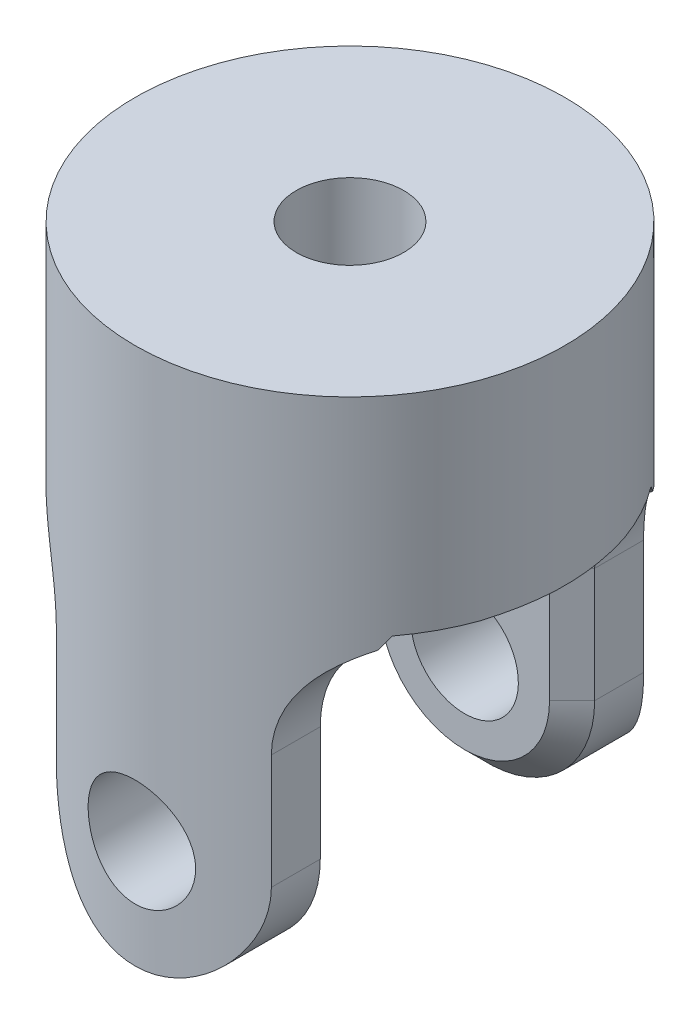
from build123d import *

# Parameters (mm, degrees)
SKETCH1_R               = 19.05
BASE_EXTRUDE_DEPTH      = 47.625
CUT_EXTRUDE1_DEPTH      = 55.716959208
CUT_EXTRUDE1_DEPTH_BACK = 55.716959208
CUT_EXTRUDE5_DEPTH      = 55.716959365
CUT_EXTRUDE5_DEPTH_BACK = 55.716959365
CUT_EXTRUDE6_DEPTH      = 55.716959365
CUT_EXTRUDE6_DEPTH_BACK = 55.716959365
SKETCH11_R              = 4.7625
SKETCH12_R              = 4.7625
CUT_EXTRUDE7_DEPTH      = 55.716959365
CHAMFER1_SIZE           = 2


with BuildPart() as part:
    # Sketch1 → Base-Extrude (new body)
    with BuildSketch(Plane(origin=(0, 0, 0), x_dir=(-1, 0, 0), z_dir=(0, 1, 0))):
        with Locations(Location((0, 0, 0), (0, 0, 90))):
            Circle(SKETCH1_R)
    extrude(amount=BASE_EXTRUDE_DEPTH)

    # Sketch2 → Cut-Extrude1 (cut, two sides: drawn at the far end of the back side and taken through both)
    with BuildSketch(Plane.XY.offset(-CUT_EXTRUDE1_DEPTH_BACK)):
        with BuildLine():
            Line((-19.05, -131.979516723), (-19.05, 0))
            Line((-19.05, 0), (-19.05, 29.21))
            ThreePointArc((-19.05, 29.21), (-12.314807909, 26.420192091), (-9.525, 19.685))
            Line((-9.525, 19.685), (-9.525, 9.525))
            ThreePointArc((-9.525, 9.525), (0, 0), (9.525, 9.525))
            Line((9.525, 9.525), (9.525, 19.685))
            ThreePointArc((9.525, 19.685), (12.314807909, 26.420192091), (19.05, 29.21))
            Line((19.05, 29.21), (19.05, 0))
            Line((19.05, 0), (19.05, -131.979516723))
            Line((19.05, -131.979516723), (19.05, -395.938550169))
            Line((19.05, -395.938550169), (-19.05, -395.938550169))
            Line((-19.05, -395.938550169), (-19.05, -131.979516723))
        make_face()
    extrude(amount=CUT_EXTRUDE1_DEPTH + CUT_EXTRUDE1_DEPTH_BACK, mode=Mode.SUBTRACT)

    # Sketch8 → Cut-Extrude5 (cut, two sides: drawn at the far end of the back side and taken through both)
    with BuildSketch(Plane(origin=(0, 0, 0), x_dir=(0, 0, -1), z_dir=(1, 0, 0)).offset(-CUT_EXTRUDE5_DEPTH_BACK)):
        Polygon((-10.16, -121.738350451), (-10.16, 0), (-10.16, 29.145238826), (10.16, 29.145238826), (10.16, 0), (10.16, -121.738350451), (10.16, -365.215051352), (-10.16, -365.215051352), align=None)
    extrude(amount=CUT_EXTRUDE5_DEPTH + CUT_EXTRUDE5_DEPTH_BACK, mode=Mode.SUBTRACT)

    # Sketch11 → Cut-Extrude6 (cut, two sides: drawn at the far end of the back side and taken through both)
    with BuildSketch(Plane.XY.offset(-CUT_EXTRUDE6_DEPTH_BACK)):
        with Locations(Location((0, 9.525, 0), (0, 0, 90))):
            Circle(SKETCH11_R)
    extrude(amount=CUT_EXTRUDE6_DEPTH + CUT_EXTRUDE6_DEPTH_BACK, mode=Mode.SUBTRACT)

    # Sketch12 → Cut-Extrude7 (cut, through all)
    with BuildSketch(Plane(origin=(0, 47.625, 0), x_dir=(-1, 0, 0), z_dir=(0, 1, 0))):
        with Locations(Location((0, 0, 0), (0, 0, 90))):
            Circle(SKETCH12_R)
    extrude(amount=-CUT_EXTRUDE7_DEPTH, mode=Mode.SUBTRACT)

    # Chamfer1
    # the kernel refuses this chamfer: 2 mm, written as the material it takes off along each edge
    with BuildSketch(Plane(origin=(19.05, 19.685, 10.16), x_dir=(-1, 0, 0), z_dir=(0, -1, 0))) as chamfer1_piece_1_section:
        Polygon((9.525, -CHAMFER1_SIZE), (9.525 + CHAMFER1_SIZE, 0), (9.525, 0), align=None)
    chamfer1_piece_1 = revolve(axis=Axis((19.05, 19.685, 10.16), (0, 0, -1)), revolution_arc=102.996714199, mode=Mode.PRIVATE)
    chamfer1_piece_1 = split(chamfer1_piece_1, bisect_by=Plane(origin=(11.833499509, 29.145238826, 10.8595535), z_dir=(0, -1, 0)), keep=Keep.TOP, mode=Mode.PRIVATE)
    add(chamfer1_piece_1, mode=Mode.SUBTRACT)
    with BuildSketch(Plane(origin=(9.525, 9.525, 10.16), x_dir=(0.027495876610586487, 0, 0.9996219169112968), z_dir=(0, 1, 0))) as chamfer1_piece_2:
        Polygon((CHAMFER1_SIZE * 0.999621916911, -CHAMFER1_SIZE * 0.0274958766106), (-CHAMFER1_SIZE * 0.0274958766106, -CHAMFER1_SIZE * 0.999621916911), (0, 0), align=None)
    extrude(amount=10.16, mode=Mode.SUBTRACT)
    with BuildSketch(Plane(origin=(0, 9.525, 10.16), x_dir=(1, 0, 0), z_dir=(0, 1, 0))) as chamfer1_piece_3:
        Polygon((9.525, -CHAMFER1_SIZE), (9.525 - CHAMFER1_SIZE, 0), (9.525, 0), align=None)
    revolve(axis=Axis((0, 9.525, 10.16), (0, 0, -1)), revolution_arc=180, mode=Mode.SUBTRACT)
    with BuildSketch(Plane(origin=(-19.05, 19.685, 10.16), x_dir=(-0.2248951759500058, 0.9743829636413066, 0), z_dir=(-0.9743829636413066, -0.2248951759500058, 0))) as chamfer1_piece_4_section:
        Polygon((9.525 + CHAMFER1_SIZE, 0), (9.525, -CHAMFER1_SIZE), (9.525, 0), align=None)
    chamfer1_piece_4 = revolve(axis=Axis((-19.05, 19.685, 10.16), (0, 0, -1)), revolution_arc=102.99671421, mode=Mode.PRIVATE)
    chamfer1_piece_4 = split(chamfer1_piece_4, bisect_by=Plane(origin=(-11.833499522, 29.145238826, 10.859553492), z_dir=(0, -1, 0)), keep=Keep.TOP, mode=Mode.PRIVATE)
    add(chamfer1_piece_4, mode=Mode.SUBTRACT)
    with BuildSketch(Plane(origin=(-9.525, 19.685, 10.16), x_dir=(0.9996219169112968, 0, -0.027495876610586487), z_dir=(0, -1, 0)), Plane(origin=(9.525, 19.685, -10.16), x_dir=(-0.9996219169112968, 0, 0.027495876610586487), z_dir=(0, -1, 0)), Plane(origin=(-9.525, 9.525, -10.16), x_dir=(0.9996219169112968, 0, 0.027495876610586487), z_dir=(0, 1, 0))) as chamfer1_piece_5:
        Polygon((CHAMFER1_SIZE * 0.999621916911, CHAMFER1_SIZE * 0.0274958766106), (-CHAMFER1_SIZE * 0.0274958766106, CHAMFER1_SIZE * 0.999621916911), (0, 0), align=None)
    extrude(amount=10.16, mode=Mode.SUBTRACT)
    with BuildSketch(Plane(origin=(19.05, 19.685, -10.16), x_dir=(-1, 0, 0), z_dir=(0, -1, 0))) as chamfer1_piece_6_section:
        Polygon((9.525 + CHAMFER1_SIZE, 0), (9.525, CHAMFER1_SIZE), (9.525, 0), align=None)
    chamfer1_piece_6 = revolve(axis=Axis((19.05, 19.685, -10.16), (0, 0, -1)), revolution_arc=102.99671421, mode=Mode.PRIVATE)
    chamfer1_piece_6 = split(chamfer1_piece_6, bisect_by=Plane(origin=(8.94755814, 29.145238826, -10.725370549), z_dir=(0, -1, 0)), keep=Keep.TOP, mode=Mode.PRIVATE)
    add(chamfer1_piece_6, mode=Mode.SUBTRACT)
    with BuildSketch(Plane(origin=(-19.05, 19.685, -10.16), x_dir=(-0.22489517574669296, 0.974382963688233, 0), z_dir=(-0.974382963688233, -0.22489517574669296, 0))) as chamfer1_piece_7_section:
        Polygon((9.525 + CHAMFER1_SIZE, 0), (9.525, CHAMFER1_SIZE), (9.525, 0), align=None)
    chamfer1_piece_7 = revolve(axis=Axis((-19.05, 19.685, -10.16), (0, 0, -1)), revolution_arc=102.996714199, mode=Mode.PRIVATE)
    chamfer1_piece_7 = split(chamfer1_piece_7, bisect_by=Plane(origin=(-11.833499512, 29.145238826, -10.859553491), z_dir=(0, -1, 0)), keep=Keep.TOP, mode=Mode.PRIVATE)
    add(chamfer1_piece_7, mode=Mode.SUBTRACT)
    with BuildSketch(Plane(origin=(0, 9.525, -10.16), x_dir=(1, 0, 0), z_dir=(0, 1, 0))) as chamfer1_piece_8:
        Polygon((9.525 - CHAMFER1_SIZE, 0), (9.525, CHAMFER1_SIZE), (9.525, 0), align=None)
    revolve(axis=Axis((0, 9.525, -10.16), (0, 0, -1)), revolution_arc=180, mode=Mode.SUBTRACT)


solid = part.part
